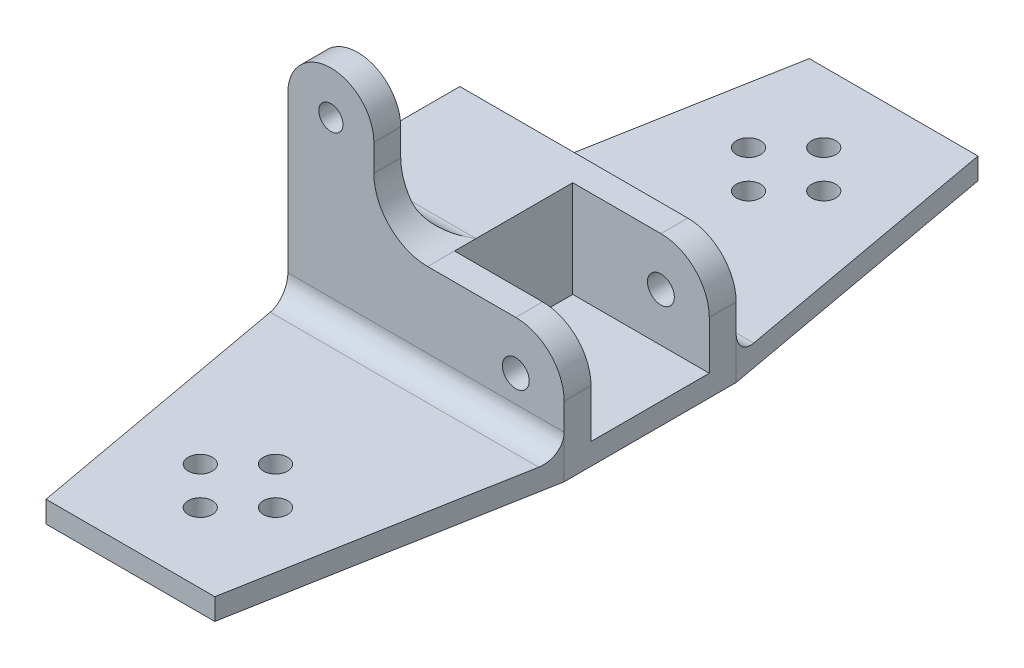
from build123d import *

# Parameters (mm, degrees)
SKETCH1_R           = 2.5
SKETCH1_R_2         = 2.25
BOSS_EXTRUDE1_DEPTH = 16
SKETCH_2_W          = 51.4
SKETCH_2_H          = 4
EXTRUDE_1_DEPTH     = 55
SKETCH_3_R          = 2.25
CUT_EXTRUDE_2_DEPTH = 55
CUT_EXTRUDE_3_DEPTH = 11
CUT_EXTRUDE_START   = -27
CUT_EXTRUDE_4_DEPTH = 27
FILLET_1_R          = 4


with BuildPart() as part:
    # Sketch1 → Boss-Extrude1 (new, symmetric)
    with BuildSketch(Plane.XY):
        with BuildLine():
            Line((-21.2, 33), (-21.2, 22))
            Line((-21.2, 22), (-21.2, 0))
            Line((-21.2, 0), (-21.2, -4))
            Line((-21.2, -4), (30.2, -4))
            Line((30.2, -4), (30.2, 9))
            ThreePointArc((30.2, 9), (27.563961031, 15.363961031), (21.2, 18))
            Line((21.2, 18), (4.8, 18))
            ThreePointArc((4.8, 18), (-2.271067812, 20.928932188), (-5.2, 28))
            Line((-5.2, 28), (-5.2, 33))
            ThreePointArc((-5.2, 33), (-13.2, 41), (-21.2, 33))
        make_face()
        with Locations((21.2, 9)):
            Circle(SKETCH1_R, mode=Mode.SUBTRACT)
        with Locations((-13.2, 33)):
            Circle(SKETCH1_R_2, mode=Mode.SUBTRACT)
    extrude(amount=BOSS_EXTRUDE1_DEPTH, both=True)

    # 草图2 → 凸台-拉伸1 (add)
    with BuildSketch(Plane.XY.offset(16)):
        with Locations((4.5, -2)):
            Rectangle(SKETCH_2_W, SKETCH_2_H)
    extrude_1 = extrude(amount=EXTRUDE_1_DEPTH)

    # 草图3 → 切除-拉伸2 (cut)
    with BuildSketch(Plane(origin=(0, 0, 0), x_dir=(1, 0, 0), z_dir=(0, 1, 0))):
        with Locations(Location((11.5, -51, 0), (0, 0, 180))):
            Circle(SKETCH_3_R)
        with Locations(Location((4.5, -44, 0), (0, 0, 180))):
            Circle(SKETCH_3_R)
        with Locations(Location((4.5, -58, 0), (0, 0, 180))):
            Circle(SKETCH_3_R)
        with Locations(Location((-2.5, -51, 0), (0, 0, 180))):
            Circle(SKETCH_3_R)
        Polygon((30.2, -16), (20.2, -71), (30.2, -71), align=None)
        Polygon((-21.2, -16), (-11.2, -71), (-21.2, -71), align=None)
    cut_extrude_2 = extrude(amount=-CUT_EXTRUDE_2_DEPTH, mode=Mode.SUBTRACT)

    # 镜向1: 凸台-拉伸1, 切除-拉伸2 across plane
    add(extrude_1.mirror(Plane.XY))
    add(cut_extrude_2.mirror(Plane.XY), mode=Mode.SUBTRACT)

    # 草图6 → 切除-拉伸3 (cut, symmetric)
    with BuildSketch(Plane.XY):
        with BuildLine():
            Line((4.8, 18), (4.8, 0))
            Line((4.8, 0), (30.2, 0))
            Line((30.2, 0), (30.2, 9))
            ThreePointArc((30.2, 9), (27.563961031, 15.363961031), (21.2, 18))
            Line((21.2, 18), (4.8, 18))
        make_face()
    extrude(amount=CUT_EXTRUDE_3_DEPTH, both=True, mode=Mode.SUBTRACT)

    # 草图7 → 切除-拉伸4 (cut)
    with BuildSketch(Plane(origin=(0, 0, -16), x_dir=(-1, 0, 0), z_dir=(0, 0, -1)).offset(CUT_EXTRUDE_START)):
        with BuildLine():
            Line((-4.8, 18), (21.2, 18))
            Line((21.2, 18), (21.2, 33))
            ThreePointArc((21.2, 33), (13.2, 41), (5.2, 33))
            Line((5.2, 33), (5.2, 28))
            ThreePointArc((5.2, 28), (2.271067812, 20.928932188), (-4.8, 18))
        make_face()
    extrude(amount=CUT_EXTRUDE_4_DEPTH, mode=Mode.SUBTRACT)

    # 圆角1
    # the kernel refuses this fillet: 4 mm, written as the material it adds along each edge
    with BuildSketch(Plane(origin=(-31.2, 0, -16), x_dir=(0, 1, 0), z_dir=(1, 0, 0))) as fillet_1_piece_1_section:
        with BuildLine():
            CenterArc((FILLET_1_R, -FILLET_1_R), FILLET_1_R, 90, 90)
            Line((0, -FILLET_1_R), (0, 0))
            Line((0, 0), (FILLET_1_R, 0))
        make_face()
    fillet_1_piece_1 = extrude(amount=71.4, mode=Mode.PRIVATE)
    fillet_1_piece_1 = split(fillet_1_piece_1, bisect_by=Plane(origin=(-20.221053864, 0.89582788, -21.384203748), z_dir=(0.9838699100999075, 0, 0.178885438199983)), keep=Keep.TOP, mode=Mode.PRIVATE)
    fillet_1_piece_1 = split(fillet_1_piece_1, bisect_by=Plane(origin=(29.221053864, 0.89582788, -21.384203748), z_dir=(-0.9838699100999075, 0, 0.1788854381999831)), keep=Keep.TOP, mode=Mode.PRIVATE)
    add(fillet_1_piece_1)
    with BuildSketch(Plane(origin=(4.8, 18, 11), x_dir=(0, 1, 0), z_dir=(-1, 0, 0))) as fillet_1_piece_2_section:
        with BuildLine():
            CenterArc((FILLET_1_R, FILLET_1_R), FILLET_1_R, 180, 90)
            Line((0, FILLET_1_R), (0, 0))
            Line((0, 0), (FILLET_1_R, 0))
        make_face()
    fillet_1_piece_2 = extrude(amount=26, mode=Mode.PRIVATE)
    fillet_1_piece_2 = fillet_1_piece_2 - Plane(origin=(4.8, 28, 10.070813785), x_dir=(0, -1, 0), z_dir=(0, 0, 1)) * Cylinder(10, 68, mode=Mode.PRIVATE)
    add(fillet_1_piece_2)
    with BuildSketch(Plane(origin=(-31.2, 0, 16), x_dir=(0, 0, 1), z_dir=(1, 0, 0))) as fillet_1_piece_3_section:
        with BuildLine():
            CenterArc((FILLET_1_R, -FILLET_1_R), FILLET_1_R, 90, 90)
            Line((0, -FILLET_1_R), (0, 0))
            Line((0, 0), (FILLET_1_R, 0))
        make_face()
    fillet_1_piece_3 = extrude(amount=71.4, mode=Mode.PRIVATE)
    fillet_1_piece_3 = split(fillet_1_piece_3, bisect_by=Plane(origin=(29.221053864, 0.89582788, 21.384203748), z_dir=(-0.9838699100999075, 0, -0.1788854381999831)), keep=Keep.TOP, mode=Mode.PRIVATE)
    fillet_1_piece_3 = split(fillet_1_piece_3, bisect_by=Plane(origin=(-20.221053864, 0.89582788, 21.384203748), z_dir=(0.9838699100999075, 0, -0.178885438199983)), keep=Keep.TOP, mode=Mode.PRIVATE)
    add(fillet_1_piece_3)


solid = part.part
